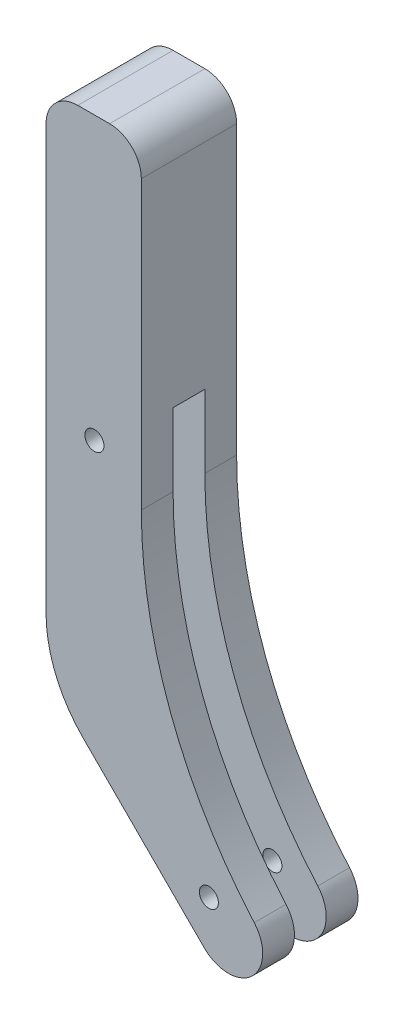
from build123d import *

# Parameters (mm, degrees)
BOSS_EXTRU_1_DEPTH      = 15
CONG_1_R                = 72
CONG_2_R                = 20
ESQUISSE2_W             = 5
ESQUISSE2_H             = 70
ENL_V_MAT_EXTRU_1_DEPTH = 90.086452972
ESQUISSE3_R             = 1.5
ENL_V_MAT_EXTRU_2_DEPTH = 90.086452972
CONG_3_R                = 5
CONG_4_START            = 9
CONG_4_DEPTH            = 7
CONG_5_START            = -1
CONG_5_DEPTH            = 7


with BuildPart() as part:
    # Esquisse1 → Boss.-Extru.1 (new body)
    with BuildSketch(Plane.XY):
        Polygon((0, 0), (0, 80), (15, 80), (15, 0), (36.213203436, -21.213203436), (28.713203436, -28.713203436), align=None)
    extrude(amount=BOSS_EXTRU_1_DEPTH)

    # Congé1
    cong_1_edges = [part.edges().sort_by_distance(p)[0] for p in [
        (15, 0, 7.5),
    ]]
    fillet(cong_1_edges, radius=CONG_1_R)

    # Congé2
    cong_2_edges = [part.edges().sort_by_distance(p)[0] for p in [
        (0, 0, 7.5),
    ]]
    fillet(cong_2_edges, radius=CONG_2_R)

    # Esquisse2 → Enlèv. mat.-Extru.1 (cut, through all)
    with BuildSketch(Plane(origin=(0, 0, 0), x_dir=(0, 0, -1), z_dir=(1, 0, 0))):
        with Locations((-7.5, 6.286796564)):
            Rectangle(ESQUISSE2_W, ESQUISSE2_H)
    extrude(amount=ENL_V_MAT_EXTRU_1_DEPTH, mode=Mode.SUBTRACT)

    # Esquisse3 → Enlèv. mat.-Extru.2 (cut, through all)
    with BuildSketch(Plane.XY.offset(15)):
        with Locations((7.61728785, 35.6306026)):
            Circle(ESQUISSE3_R)
        with Locations((25.630175336, -17.654095912)):
            Circle(ESQUISSE3_R)
    extrude(amount=-ENL_V_MAT_EXTRU_2_DEPTH, mode=Mode.SUBTRACT)

    # Congé3
    cong_3_edges = [part.edges().sort_by_distance(p)[0] for p in [
        (0, 80, 7.5),
        (15, 80, 7.5),
    ]]
    fillet(cong_3_edges, radius=CONG_3_R)

    # Congé4: read off the stored shape, not the designer's step
    # Congé4 outline → Congé4 (cut)
    with BuildSketch(Plane.XY.offset(CONG_4_START)):
        with BuildLine():
            ThreePointArc((36.088311756, -21.088311756), (34.40105692, -19.343189251), (32.773587535, -17.542182633))
            add(Edge.make_bspline(
                [(32.773587535, -17.542182633), (34.472065544, -19.486683464), (34.913542675, -22.512864199), (32.525386467, -24.901020408)],
                knots=[0, 0, 0, 0, 0.49128121, 0.49128121, 0.49128121, 0.49128121], degree=3, weights=[1, 0.683519634, 0.522520126, 0.517001474]))
            Line((32.525386467, -24.901020408), (36.213203437, -21.213203437))
            Line((36.213203437, -21.213203437), (36.088311756, -21.088311756))
        make_face()
        with BuildLine():
            Line((28.713203437, -28.713203437), (32.525386467, -24.901020408))
            add(Edge.make_bspline(
                [(32.525386467, -24.901020408), (29.99813373, -27.428273144), (26.823045344, -26.823045346), (24.901020406, -24.901020406)],
                knots=[0.49128121, 0.49128121, 0.49128121, 0.49128121, 1, 1, 1, 1], degree=3, weights=[0.517001474, 0.511286943, 0.672286452, 1]))
            Line((24.901020406, -24.901020406), (28.713203437, -28.713203437))
        make_face()
    extrude(amount=CONG_4_DEPTH, mode=Mode.SUBTRACT)

    # Congé5: read off the stored shape, not the designer's step
    # Congé5 outline → Congé5 (cut)
    with BuildSketch(Plane.XY.offset(CONG_5_START)):
        with BuildLine():
            ThreePointArc((36.088311755, -21.088311755), (34.401056918, -19.343189249), (32.773587531, -17.542182629))
            add(Edge.make_bspline(
                [(32.773587531, -17.542182629), (34.472065541, -19.486683459), (34.913542673, -22.512864192), (32.525386468, -24.901020401)],
                knots=[0, 0, 0, 0, 0.49128121, 0.49128121, 0.49128121, 0.49128121], degree=3, weights=[1, 0.683519634, 0.522520126, 0.517001474]))
            Line((32.525386468, -24.901020401), (36.213203436, -21.213203436))
            Line((36.213203436, -21.213203436), (36.088311755, -21.088311755))
        make_face()
        with BuildLine():
            Line((28.713203436, -28.713203436), (32.525386468, -24.901020401))
            add(Edge.make_bspline(
                [(32.525386468, -24.901020401), (29.998133731, -27.428273143), (26.823045342, -26.823045344), (24.901020402, -24.901020402)],
                knots=[0.49128121, 0.49128121, 0.49128121, 0.49128121, 1, 1, 1, 1], degree=3, weights=[0.517001474, 0.511286943, 0.672286451, 1]))
            Line((24.901020402, -24.901020402), (28.713203436, -28.713203436))
        make_face()
    extrude(amount=CONG_5_DEPTH, mode=Mode.SUBTRACT)


solid = part.part
